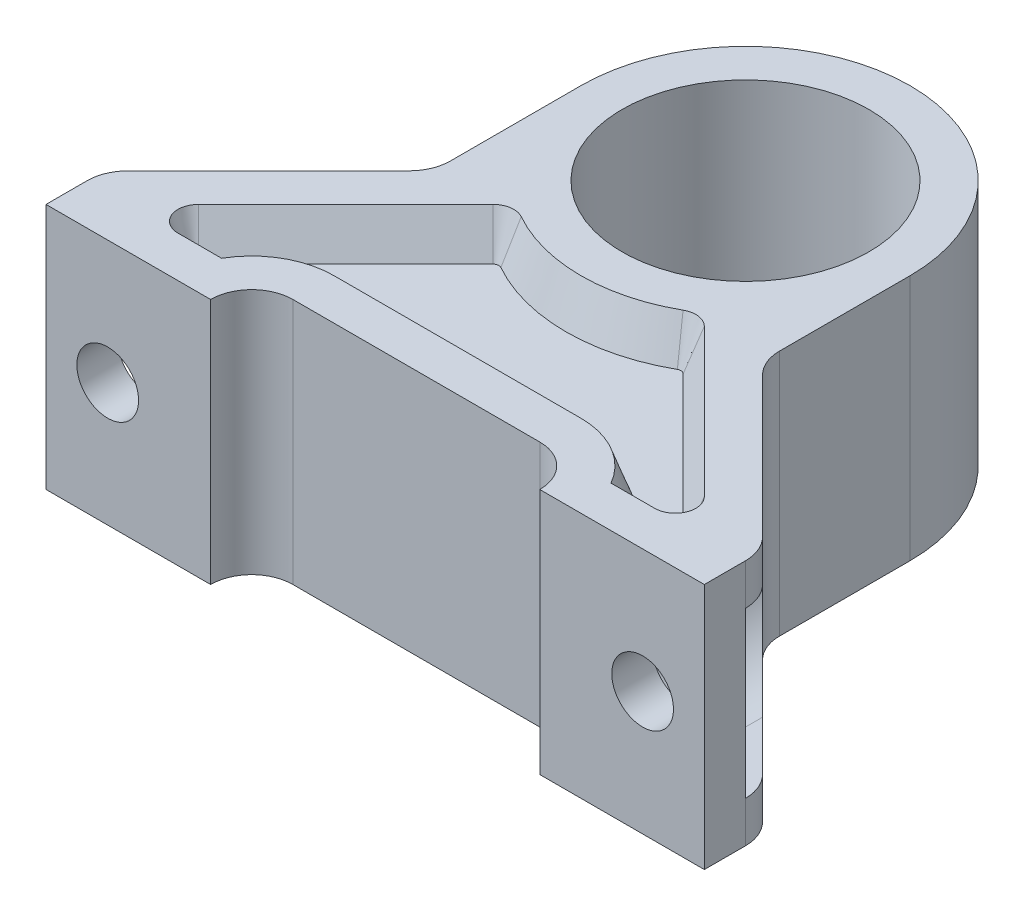
from build123d import *
from OCP.BRepFilletAPI import BRepFilletAPI_MakeChamfer

# Parameters (mm, degrees)
SKETCH1_R                  = 38.1
BOSS_EXTRUDE1_DEPTH        = 76.2
CUT_EXTRUDE1_DEPTH         = 273.680564031
CUT_EXTRUDE2_START         = -12.7
CUT_EXTRUDE2_DEPTH         = 260.980564031
SKETCH5_R                  = 9.525
CUT_EXTRUDE3_DEPTH         = 266.183785326
CUT_EXTRUDE4_START         = -12.7
CUT_EXTRUDE4_DEPTH         = 12.7
CHAMFER1_SIZE              = 12.7
CHAMFER1_SIZE_2            = 4.622421975
CHAMFER1_OF_MIRROR2_SIZE   = 12.7
CHAMFER1_OF_MIRROR2_SIZE_2 = 4.622421975


with BuildPart() as part:
    # Sketch1 → Boss-Extrude1 (new body)
    with BuildSketch(Plane(origin=(0, 0, 0), x_dir=(1, 0, 0), z_dir=(0, 1, 0))):
        with BuildLine():
            Line((0, 0), (-203.2, 0))
            Line((-203.2, 0), (-203.2, 12.7))
            ThreePointArc((-203.2, 12.7), (-202.233270063, 17.560079591), (-199.480256121, 21.680256121))
            Line((-199.480256121, 21.680256121), (-156.119743879, 65.040768363))
            ThreePointArc((-156.119743879, 65.040768363), (-153.366729937, 69.160944893), (-152.4, 74.021024484))
            Line((-152.4, 74.021024484), (-152.4, 114.3))
            ThreePointArc((-152.4, 114.3), (-101.6, 165.1), (-50.8, 114.3))
            Line((-50.8, 114.3), (-50.8, 74.021024484))
            ThreePointArc((-50.8, 74.021024484), (-49.833270063, 69.160944893), (-47.080256121, 65.040768363))
            Line((-47.080256121, 65.040768363), (-3.719743879, 21.680256121))
            ThreePointArc((-3.719743879, 21.680256121), (-0.966729937, 17.560079591), (0, 12.7))
            Line((0, 12.7), (0, 0))
        make_face()
        with Locations(Location((-101.6, 114.3, 0), (0, 0, 90))):
            Circle(SKETCH1_R, mode=Mode.SUBTRACT)
    extrude(amount=BOSS_EXTRUDE1_DEPTH)

    # Sketch2 → Cut-Extrude1 (cut, through all)
    with BuildSketch(Plane(origin=(0, 76.2, 0), x_dir=(1, 0, 0), z_dir=(0, 1, 0))):
        with BuildLine():
            Line((-139.7, 12.7), (-63.5, 12.7))
            ThreePointArc((-63.5, 12.7), (-50.8, 0), (-63.5, -12.7))
            Line((-63.5, -12.7), (-139.7, -12.7))
            ThreePointArc((-139.7, -12.7), (-152.4, 0), (-139.7, 12.7))
        make_face()
    extrude(amount=-CUT_EXTRUDE1_DEPTH, mode=Mode.SUBTRACT)

    # Sketch4 → Cut-Extrude2 (cut, through all)
    with BuildSketch(Plane.XY.offset(CUT_EXTRUDE2_START)):
        with BuildLine():
            Line((0, 63.5), (-19.05, 63.5))
            ThreePointArc((-19.05, 63.5), (-44.45, 38.1), (-19.05, 12.7))
            Line((-19.05, 12.7), (0, 12.7))
            Line((0, 12.7), (0, 63.5))
        make_face()
    cut_extrude2 = extrude(amount=-CUT_EXTRUDE2_DEPTH, mode=Mode.SUBTRACT)

    # Sketch5 → Cut-Extrude3 (cut, through all)
    with BuildSketch(Plane(origin=(0, 0, -12.7), x_dir=(-1, 0, 0), z_dir=(0, 0, -1))):
        with Locations((19.05, 38.1)):
            Circle(SKETCH5_R)
    cut_extrude3 = extrude(amount=-CUT_EXTRUDE3_DEPTH, mode=Mode.SUBTRACT)

    # Mirror1: Cut-Extrude2, Cut-Extrude3 across plane
    add(cut_extrude2.mirror(Plane(origin=(-101.6, 0, 0), x_dir=(0, 0, 1), z_dir=(1, 0, 0))), mode=Mode.SUBTRACT)
    add(cut_extrude3.mirror(Plane(origin=(-101.6, 0, 0), x_dir=(0, 0, 1), z_dir=(1, 0, 0))), mode=Mode.SUBTRACT)

    # Sketch6 → Cut-Extrude4 (cut)
    with BuildSketch(Plane(origin=(0, 76.2, 0), x_dir=(1, 0, 0), z_dir=(0, 1, 0)).offset(CUT_EXTRUDE4_START)):
        with BuildLine():
            Line((-23.540128061, 23.540128061), (-69.01989759, 69.01989759))
            ThreePointArc((-69.01989759, 69.01989759), (-72.650432416, 70.821319376), (-76.631133912, 70.059795138))
            ThreePointArc((-76.631133912, 70.059795138), (-101.6, 63.5), (-126.568866088, 70.059795138))
            ThreePointArc((-126.568866088, 70.059795138), (-130.549567584, 70.821319376), (-134.18010241, 69.01989759))
            Line((-134.18010241, 69.01989759), (-179.659871939, 23.540128061))
            ThreePointArc((-179.659871939, 23.540128061), (-181.03637891, 16.619960204), (-175.169743879, 12.7))
            Line((-175.169743879, 12.7), (-161.697045256, 12.7))
            ThreePointArc((-161.697045256, 12.7), (-152.4, 21.997045256), (-139.7, 25.4))
            Line((-139.7, 25.4), (-63.5, 25.4))
            ThreePointArc((-63.5, 25.4), (-50.8, 21.997045256), (-41.502954744, 12.7))
            Line((-41.502954744, 12.7), (-28.030256121, 12.7))
            ThreePointArc((-28.030256121, 12.7), (-22.16362109, 16.619960204), (-23.540128061, 23.540128061))
        make_face()
    cut_extrude4 = extrude(amount=CUT_EXTRUDE4_DEPTH, mode=Mode.SUBTRACT)

    # Chamfer1
    chamfer1_edges_1 = [part.edges().sort_by_distance(p)[0] for p in [
        (-46.280012825, 63.5, -46.280012825),
    ]]
    chamfer1_side_1 = [part.faces().sort_by_distance(p)[0] for p in [
        (-46.280012825, 63.59244844, -46.280012825),
    ]]
    chamfer1_edges_2 = [part.edges().sort_by_distance(p)[0] for p in [
        (-22.16362109, 63.5, -16.619960204),
    ]]
    chamfer1_side_2 = [part.faces().sort_by_distance(p)[0] for p in [
        (-22.16362109, 63.59244844, -16.619960204),
    ]]
    chamfer1_edges_3 = [part.edges().sort_by_distance(p)[0] for p in [
        (-34.766605432, 63.5, -12.7),
    ]]
    chamfer1_side_3 = [part.faces().sort_by_distance(p)[0] for p in [
        (-34.766605432, 63.59244844, -12.7),
    ]]
    chamfer1_edges_4 = [part.edges().sort_by_distance(p)[0] for p in [
        (-50.8, 63.5, -21.997045256),
    ]]
    chamfer1_side_4 = [part.faces().sort_by_distance(p)[0] for p in [
        (-50.8, 63.59244844, -21.997045256),
    ]]
    chamfer1_edges_5 = [part.edges().sort_by_distance(p)[0] for p in [
        (-101.6, 63.5, -25.4),
    ]]
    chamfer1_side_5 = [part.faces().sort_by_distance(p)[0] for p in [
        (-101.6, 63.59244844, -25.4),
    ]]
    chamfer1_edges_6 = [part.edges().sort_by_distance(p)[0] for p in [
        (-152.4, 63.5, -21.997045256),
    ]]
    chamfer1_side_6 = [part.faces().sort_by_distance(p)[0] for p in [
        (-152.4, 63.59244844, -21.997045256),
    ]]
    chamfer1_edges_7 = [part.edges().sort_by_distance(p)[0] for p in [
        (-168.433394568, 63.5, -12.7),
    ]]
    chamfer1_side_7 = [part.faces().sort_by_distance(p)[0] for p in [
        (-168.433394568, 63.59244844, -12.7),
    ]]
    chamfer1_edges_8 = [part.edges().sort_by_distance(p)[0] for p in [
        (-181.03637891, 63.5, -16.619960204),
    ]]
    chamfer1_side_8 = [part.faces().sort_by_distance(p)[0] for p in [
        (-181.03637891, 63.59244844, -16.619960204),
    ]]
    chamfer1_edges_9 = [part.edges().sort_by_distance(p)[0] for p in [
        (-156.919987175, 63.5, -46.280012825),
    ]]
    chamfer1_side_9 = [part.faces().sort_by_distance(p)[0] for p in [
        (-156.919987175, 63.59244844, -46.280012825),
    ]]
    chamfer1_edges_10 = [part.edges().sort_by_distance(p)[0] for p in [
        (-130.549567584, 63.5, -70.821319376),
    ]]
    chamfer1_side_10 = [part.faces().sort_by_distance(p)[0] for p in [
        (-130.549567584, 63.59244844, -70.821319376),
    ]]
    chamfer1_edges_11 = [part.edges().sort_by_distance(p)[0] for p in [
        (-101.6, 63.5, -63.5),
    ]]
    chamfer1_side_11 = [part.faces().sort_by_distance(p)[0] for p in [
        (-101.6, 63.59244844, -63.5),
    ]]
    chamfer1_edges_12 = [part.edges().sort_by_distance(p)[0] for p in [
        (-72.650432416, 63.5, -70.821319376),
    ]]
    chamfer1_side_12 = [part.faces().sort_by_distance(p)[0] for p in [
        (-72.650432416, 63.59244844, -70.821319376),
    ]]
    chamfer1 = BRepFilletAPI_MakeChamfer(part.part.solid().wrapped)
    for e in chamfer1_edges_1:
        chamfer1.Add(CHAMFER1_SIZE - 0.0001, CHAMFER1_SIZE_2 - 0.0001, e.wrapped, chamfer1_side_1[0].wrapped)
    for e in chamfer1_edges_2:
        chamfer1.Add(CHAMFER1_SIZE - 0.0001, CHAMFER1_SIZE_2 - 0.0001, e.wrapped, chamfer1_side_2[0].wrapped)
    for e in chamfer1_edges_3:
        chamfer1.Add(CHAMFER1_SIZE - 0.0001, CHAMFER1_SIZE_2 - 0.0001, e.wrapped, chamfer1_side_3[0].wrapped)
    for e in chamfer1_edges_4:
        chamfer1.Add(CHAMFER1_SIZE - 0.0001, CHAMFER1_SIZE_2 - 0.0001, e.wrapped, chamfer1_side_4[0].wrapped)
    for e in chamfer1_edges_5:
        chamfer1.Add(CHAMFER1_SIZE - 0.0001, CHAMFER1_SIZE_2 - 0.0001, e.wrapped, chamfer1_side_5[0].wrapped)
    for e in chamfer1_edges_6:
        chamfer1.Add(CHAMFER1_SIZE - 0.0001, CHAMFER1_SIZE_2 - 0.0001, e.wrapped, chamfer1_side_6[0].wrapped)
    for e in chamfer1_edges_7:
        chamfer1.Add(CHAMFER1_SIZE - 0.0001, CHAMFER1_SIZE_2 - 0.0001, e.wrapped, chamfer1_side_7[0].wrapped)
    for e in chamfer1_edges_8:
        chamfer1.Add(CHAMFER1_SIZE - 0.0001, CHAMFER1_SIZE_2 - 0.0001, e.wrapped, chamfer1_side_8[0].wrapped)
    for e in chamfer1_edges_9:
        chamfer1.Add(CHAMFER1_SIZE - 0.0001, CHAMFER1_SIZE_2 - 0.0001, e.wrapped, chamfer1_side_9[0].wrapped)
    for e in chamfer1_edges_10:
        chamfer1.Add(CHAMFER1_SIZE - 0.0001, CHAMFER1_SIZE_2 - 0.0001, e.wrapped, chamfer1_side_10[0].wrapped)
    for e in chamfer1_edges_11:
        chamfer1.Add(CHAMFER1_SIZE - 0.0001, CHAMFER1_SIZE_2 - 0.0001, e.wrapped, chamfer1_side_11[0].wrapped)
    for e in chamfer1_edges_12:
        chamfer1.Add(CHAMFER1_SIZE - 0.0001, CHAMFER1_SIZE_2 - 0.0001, e.wrapped, chamfer1_side_12[0].wrapped)
    add(Compound.cast(chamfer1.Shape()), mode=Mode.REPLACE)  # a hair under: the kernel refuses the full size

    # Mirror2: Cut-Extrude4 across plane
    add(cut_extrude4.mirror(Plane.ZX.offset(38.1)), mode=Mode.SUBTRACT)

    # Chamfer1 of Mirror2
    chamfer1_of_mirror2_edges_1 = [part.edges().sort_by_distance(p)[0] for p in [
        (-46.280012825, 12.7, -46.280012825),
    ]]
    chamfer1_of_mirror2_side_1 = [part.faces().sort_by_distance(p)[0] for p in [
        (-46.280012825, 12.60755156, -46.280012825),
    ]]
    chamfer1_of_mirror2_edges_2 = [part.edges().sort_by_distance(p)[0] for p in [
        (-22.16362109, 12.7, -16.619960204),
    ]]
    chamfer1_of_mirror2_side_2 = [part.faces().sort_by_distance(p)[0] for p in [
        (-22.16362109, 12.60755156, -16.619960204),
    ]]
    chamfer1_of_mirror2_edges_3 = [part.edges().sort_by_distance(p)[0] for p in [
        (-34.766605432, 12.7, -12.7),
    ]]
    chamfer1_of_mirror2_side_3 = [part.faces().sort_by_distance(p)[0] for p in [
        (-34.766605432, 12.60755156, -12.7),
    ]]
    chamfer1_of_mirror2_edges_4 = [part.edges().sort_by_distance(p)[0] for p in [
        (-50.8, 12.7, -21.997045256),
    ]]
    chamfer1_of_mirror2_side_4 = [part.faces().sort_by_distance(p)[0] for p in [
        (-50.8, 12.60755156, -21.997045256),
    ]]
    chamfer1_of_mirror2_edges_5 = [part.edges().sort_by_distance(p)[0] for p in [
        (-101.6, 12.7, -25.4),
    ]]
    chamfer1_of_mirror2_side_5 = [part.faces().sort_by_distance(p)[0] for p in [
        (-101.6, 12.60755156, -25.4),
    ]]
    chamfer1_of_mirror2_edges_6 = [part.edges().sort_by_distance(p)[0] for p in [
        (-152.4, 12.7, -21.997045256),
    ]]
    chamfer1_of_mirror2_side_6 = [part.faces().sort_by_distance(p)[0] for p in [
        (-152.4, 12.60755156, -21.997045256),
    ]]
    chamfer1_of_mirror2_edges_7 = [part.edges().sort_by_distance(p)[0] for p in [
        (-168.433394568, 12.7, -12.7),
    ]]
    chamfer1_of_mirror2_side_7 = [part.faces().sort_by_distance(p)[0] for p in [
        (-168.433394568, 12.60755156, -12.7),
    ]]
    chamfer1_of_mirror2_edges_8 = [part.edges().sort_by_distance(p)[0] for p in [
        (-181.03637891, 12.7, -16.619960204),
    ]]
    chamfer1_of_mirror2_side_8 = [part.faces().sort_by_distance(p)[0] for p in [
        (-181.03637891, 12.60755156, -16.619960204),
    ]]
    chamfer1_of_mirror2_edges_9 = [part.edges().sort_by_distance(p)[0] for p in [
        (-156.919987175, 12.7, -46.280012825),
    ]]
    chamfer1_of_mirror2_side_9 = [part.faces().sort_by_distance(p)[0] for p in [
        (-156.919987175, 12.60755156, -46.280012825),
    ]]
    chamfer1_of_mirror2_edges_10 = [part.edges().sort_by_distance(p)[0] for p in [
        (-130.549567584, 12.7, -70.821319376),
    ]]
    chamfer1_of_mirror2_side_10 = [part.faces().sort_by_distance(p)[0] for p in [
        (-130.549567584, 12.60755156, -70.821319376),
    ]]
    chamfer1_of_mirror2_edges_11 = [part.edges().sort_by_distance(p)[0] for p in [
        (-101.6, 12.7, -63.5),
    ]]
    chamfer1_of_mirror2_side_11 = [part.faces().sort_by_distance(p)[0] for p in [
        (-101.6, 12.60755156, -63.5),
    ]]
    chamfer1_of_mirror2_edges_12 = [part.edges().sort_by_distance(p)[0] for p in [
        (-72.650432416, 12.7, -70.821319376),
    ]]
    chamfer1_of_mirror2_side_12 = [part.faces().sort_by_distance(p)[0] for p in [
        (-72.650432416, 12.60755156, -70.821319376),
    ]]
    chamfer1_of_mirror2 = BRepFilletAPI_MakeChamfer(part.part.solid().wrapped)
    for e in chamfer1_of_mirror2_edges_1:
        chamfer1_of_mirror2.Add(CHAMFER1_OF_MIRROR2_SIZE - 0.0001, CHAMFER1_OF_MIRROR2_SIZE_2 - 0.0001, e.wrapped, chamfer1_of_mirror2_side_1[0].wrapped)
    for e in chamfer1_of_mirror2_edges_2:
        chamfer1_of_mirror2.Add(CHAMFER1_OF_MIRROR2_SIZE - 0.0001, CHAMFER1_OF_MIRROR2_SIZE_2 - 0.0001, e.wrapped, chamfer1_of_mirror2_side_2[0].wrapped)
    for e in chamfer1_of_mirror2_edges_3:
        chamfer1_of_mirror2.Add(CHAMFER1_OF_MIRROR2_SIZE - 0.0001, CHAMFER1_OF_MIRROR2_SIZE_2 - 0.0001, e.wrapped, chamfer1_of_mirror2_side_3[0].wrapped)
    for e in chamfer1_of_mirror2_edges_4:
        chamfer1_of_mirror2.Add(CHAMFER1_OF_MIRROR2_SIZE - 0.0001, CHAMFER1_OF_MIRROR2_SIZE_2 - 0.0001, e.wrapped, chamfer1_of_mirror2_side_4[0].wrapped)
    for e in chamfer1_of_mirror2_edges_5:
        chamfer1_of_mirror2.Add(CHAMFER1_OF_MIRROR2_SIZE - 0.0001, CHAMFER1_OF_MIRROR2_SIZE_2 - 0.0001, e.wrapped, chamfer1_of_mirror2_side_5[0].wrapped)
    for e in chamfer1_of_mirror2_edges_6:
        chamfer1_of_mirror2.Add(CHAMFER1_OF_MIRROR2_SIZE - 0.0001, CHAMFER1_OF_MIRROR2_SIZE_2 - 0.0001, e.wrapped, chamfer1_of_mirror2_side_6[0].wrapped)
    for e in chamfer1_of_mirror2_edges_7:
        chamfer1_of_mirror2.Add(CHAMFER1_OF_MIRROR2_SIZE - 0.0001, CHAMFER1_OF_MIRROR2_SIZE_2 - 0.0001, e.wrapped, chamfer1_of_mirror2_side_7[0].wrapped)
    for e in chamfer1_of_mirror2_edges_8:
        chamfer1_of_mirror2.Add(CHAMFER1_OF_MIRROR2_SIZE - 0.0001, CHAMFER1_OF_MIRROR2_SIZE_2 - 0.0001, e.wrapped, chamfer1_of_mirror2_side_8[0].wrapped)
    for e in chamfer1_of_mirror2_edges_9:
        chamfer1_of_mirror2.Add(CHAMFER1_OF_MIRROR2_SIZE - 0.0001, CHAMFER1_OF_MIRROR2_SIZE_2 - 0.0001, e.wrapped, chamfer1_of_mirror2_side_9[0].wrapped)
    for e in chamfer1_of_mirror2_edges_10:
        chamfer1_of_mirror2.Add(CHAMFER1_OF_MIRROR2_SIZE - 0.0001, CHAMFER1_OF_MIRROR2_SIZE_2 - 0.0001, e.wrapped, chamfer1_of_mirror2_side_10[0].wrapped)
    for e in chamfer1_of_mirror2_edges_11:
        chamfer1_of_mirror2.Add(CHAMFER1_OF_MIRROR2_SIZE - 0.0001, CHAMFER1_OF_MIRROR2_SIZE_2 - 0.0001, e.wrapped, chamfer1_of_mirror2_side_11[0].wrapped)
    for e in chamfer1_of_mirror2_edges_12:
        chamfer1_of_mirror2.Add(CHAMFER1_OF_MIRROR2_SIZE - 0.0001, CHAMFER1_OF_MIRROR2_SIZE_2 - 0.0001, e.wrapped, chamfer1_of_mirror2_side_12[0].wrapped)
    add(Compound.cast(chamfer1_of_mirror2.Shape()), mode=Mode.REPLACE)  # a hair under: the kernel refuses the full size


solid = part.part
